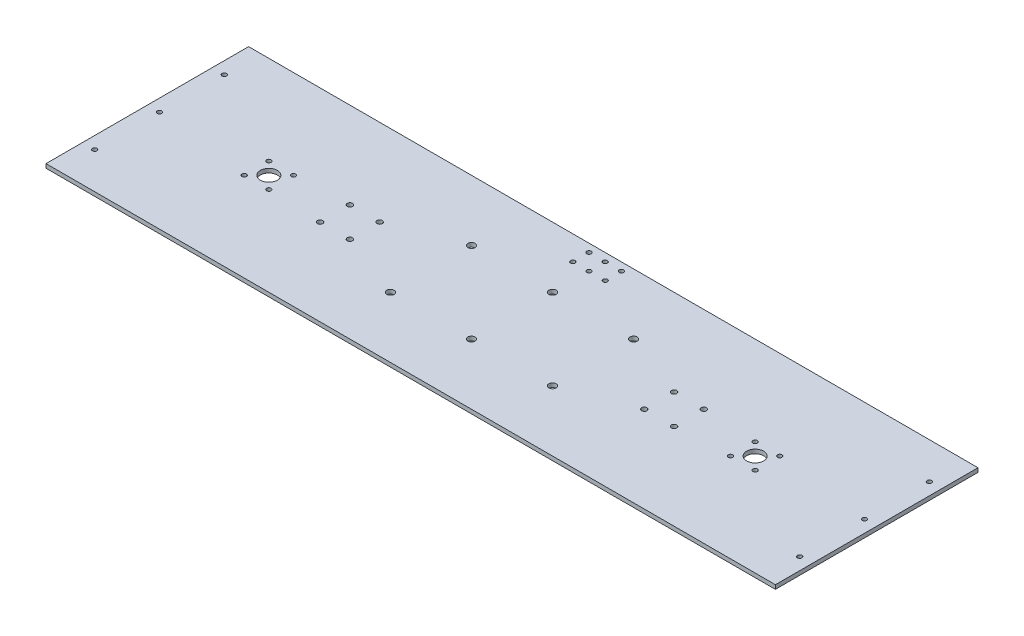
from build123d import *

# Parameters (mm, degrees)
SKETCH_1_W          = 900
SKETCH_1_H          = 250
SKETCH_1_R          = 4.5
SKETCH_1_R_2        = 10.5
SKETCH_1_R_3        = 2.75
SKETCH_1_R_4        = 3.3
EXTRUDE_1_DEPTH     = 5
SKETCH_2_R          = 2.75
CUT_EXTRUDE_1_DEPTH = 935.090466711


with BuildPart() as part:
    # 草图1 → 凸台-拉伸1 (new body)
    with BuildSketch(Plane(origin=(0, 0, 0), x_dir=(1, 0, 0), z_dir=(0, 1, 0))):
        with Locations((-450, 125)):
            Rectangle(SKETCH_1_W, SKETCH_1_H)
        with Locations((-550, 175)):
            Circle(SKETCH_1_R, mode=Mode.SUBTRACT)
        with Locations((-450, 175)):
            Circle(SKETCH_1_R, mode=Mode.SUBTRACT)
        with Locations((-350, 175)):
            Circle(SKETCH_1_R, mode=Mode.SUBTRACT)
        with Locations((-350, 75)):
            Circle(SKETCH_1_R, mode=Mode.SUBTRACT)
        with Locations((-450, 75)):
            Circle(SKETCH_1_R, mode=Mode.SUBTRACT)
        with Locations((-550, 75)):
            Circle(SKETCH_1_R, mode=Mode.SUBTRACT)
        with Locations((-750, 125)):
            Circle(SKETCH_1_R_2, mode=Mode.SUBTRACT)
        with Locations((-150, 125)):
            Circle(SKETCH_1_R_2, mode=Mode.SUBTRACT)
        with Locations((-765.202795796, 140.202795796)):
            Circle(SKETCH_1_R_3, mode=Mode.SUBTRACT)
        with Locations((-668.384776311, 143.384776311)):
            Circle(SKETCH_1_R_4, mode=Mode.SUBTRACT)
        with Locations((-231.615223689, 143.384776311)):
            Circle(SKETCH_1_R_4, mode=Mode.SUBTRACT)
        with Locations((-134.797204204, 140.202795796)):
            Circle(SKETCH_1_R_3, mode=Mode.SUBTRACT)
        with Locations((-734.797204204, 140.202795796)):
            Circle(SKETCH_1_R_3, mode=Mode.SUBTRACT)
        with Locations((-734.797204204, 109.797204204)):
            Circle(SKETCH_1_R_3, mode=Mode.SUBTRACT)
        with Locations((-765.202795796, 109.797204204)):
            Circle(SKETCH_1_R_3, mode=Mode.SUBTRACT)
        with Locations((-631.615223689, 143.384776311)):
            Circle(SKETCH_1_R_4, mode=Mode.SUBTRACT)
        with Locations((-631.615223689, 106.615223689)):
            Circle(SKETCH_1_R_4, mode=Mode.SUBTRACT)
        with Locations((-668.384776311, 106.615223689)):
            Circle(SKETCH_1_R_4, mode=Mode.SUBTRACT)
        with Locations((-268.384776311, 143.384776311)):
            Circle(SKETCH_1_R_4, mode=Mode.SUBTRACT)
        with Locations((-268.384776311, 106.615223689)):
            Circle(SKETCH_1_R_4, mode=Mode.SUBTRACT)
        with Locations((-231.615223689, 106.615223689)):
            Circle(SKETCH_1_R_4, mode=Mode.SUBTRACT)
        with Locations((-165.202795796, 109.797204204)):
            Circle(SKETCH_1_R_3, mode=Mode.SUBTRACT)
        with Locations((-134.797204204, 109.797204204)):
            Circle(SKETCH_1_R_3, mode=Mode.SUBTRACT)
        with Locations((-165.202795796, 140.202795796)):
            Circle(SKETCH_1_R_3, mode=Mode.SUBTRACT)
    extrude(amount=EXTRUDE_1_DEPTH)

    # 草图2 → 切除-拉伸1 (cut, through all)
    with BuildSketch(Plane(origin=(0, 5, 0), x_dir=(1, 0, 0), z_dir=(0, 1, 0))):
        with Locations((-470, 240)):
            Circle(SKETCH_2_R)
        with Locations((-430, 240)):
            Circle(SKETCH_2_R)
        with Locations((-430, 220)):
            Circle(SKETCH_2_R)
        with Locations((-470, 220)):
            Circle(SKETCH_2_R)
        with Locations((-450, 220)):
            Circle(SKETCH_2_R)
        with Locations((-450, 240)):
            Circle(SKETCH_2_R)
        with Locations((-885, 205)):
            Circle(SKETCH_2_R)
        with Locations((-885, 125)):
            Circle(SKETCH_2_R)
        with Locations((-885, 45)):
            Circle(SKETCH_2_R)
        with Locations((-15, 205)):
            Circle(SKETCH_2_R)
        with Locations((-15, 125)):
            Circle(SKETCH_2_R)
        with Locations((-15, 45)):
            Circle(SKETCH_2_R)
    extrude(amount=-CUT_EXTRUDE_1_DEPTH, mode=Mode.SUBTRACT)


solid = part.part
